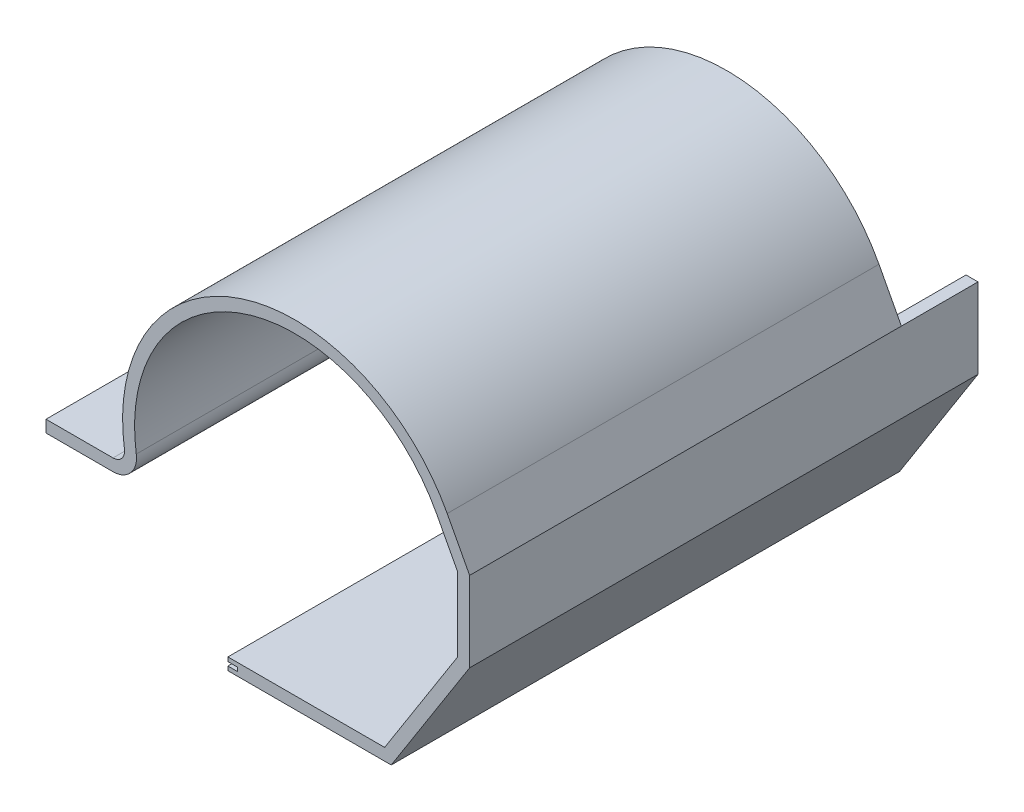
from build123d import *

# Parameters (mm, degrees)
SKETCH3_W                = 40
SKETCH3_H                = 30
SKETCH3_R                = 2.5
BOSS_EXTRUDE2_DEPTH      = 6.25
SKETCH4_W                = 40
SKETCH4_H                = 6.25
BOSS_EXTRUDE3_DEPTH      = 7.5
BOSS_EXTRUDE4_DEPTH      = 20
CHAMFER1_SIZE            = 2.5
SKETCH6_R                = 38
BOSS_EXTRUDE5_DEPTH      = 12.25
SKETCH8_R                = 28
BOSS_EXTRUDE7_DEPTH      = 10.5
SKETCH9_R                = 31.125
BOSS_EXTRUDE8_DEPTH      = 3.125
FILLET1_R                = 4
BOSS_EXTRUDE9_DEPTH      = 90
CHAMFER1_OF_MIRROR1_SIZE = 2.5
FILLET1_OF_MIRROR1_R     = 4
SKETCH12_R               = 2.5
BOSS_EXTRUDE10_DEPTH     = 30
SKETCH14_R               = 2.5
CUT_EXTRUDE1_DEPTH       = 10
CUT_EXTRUDE2_DEPTH       = 50
SKETCH17_W               = 1
SKETCH17_H               = 6.235194638
BOSS_EXTRUDE11_DEPTH     = 5
FILLET2_R                = 0.5
FILLET3_R                = 0.5
SKETCH18_W               = 524.380672346
SKETCH18_H               = 94.959875778
CUT_EXTRUDE3_DEPTH       = 174
SKETCH19_W               = 272.949766815
SKETCH19_H               = 179.225609408
CUT_EXTRUDE4_DEPTH       = 174


with BuildPart() as part:
    # Sketch3 → Boss-Extrude2 (new body)
    with BuildSketch(Plane.XY):
        with Locations((0, -25)):
            Rectangle(SKETCH3_W, SKETCH3_H)
        with Locations((7.5, -25)):
            Circle(SKETCH3_R, mode=Mode.SUBTRACT)
        with Locations((-7.5, -25)):
            Circle(SKETCH3_R, mode=Mode.SUBTRACT)
    boss_extrude2 = extrude(amount=BOSS_EXTRUDE2_DEPTH)

    # Sketch4 → Boss-Extrude3 (add)
    with BuildSketch(Plane.XY.offset(6.25)):
        with Locations((0, -36.875)):
            Rectangle(SKETCH4_W, SKETCH4_H)
    boss_extrude3 = extrude(amount=BOSS_EXTRUDE3_DEPTH)

    # Sketch5 → Boss-Extrude4 (add)
    with BuildSketch(Plane.XY.offset(13.75)):
        Polygon((-20, -40), (-88.428700673, -40), (-107.5, -10), (-107.5, 10), (-110.625, 10), (-110.625, -10.909213368), (-90.145103003, -43.125), (90.145103003, -43.125), (110.625, -10.909213368), (110.625, 10), (107.5, 10), (107.5, -10), (88.428700673, -40), (20, -40), align=None)
    boss_extrude4 = extrude(amount=-BOSS_EXTRUDE4_DEPTH)

    # Chamfer1
    chamfer1_edges = [part.edges().sort_by_distance(p)[0] for p in [
        (-20, -40, 6.875),
        (-20, -10, 3.125),
        (20, -10, 3.125),
        (20, -40, 6.875),
    ]]
    chamfer(chamfer1_edges, length=CHAMFER1_SIZE)

    # Sketch6 → Boss-Extrude5 (add)
    with BuildSketch(Plane.XY.offset(13.75)):
        with BuildLine():
            Line((-110.625, 10), (-104.767593775, 21.060353399))
            ThreePointArc((-104.767593775, 21.060353399), (-50.991609061, 42.764061819), (-20.479289941, -6.550295858))
            ThreePointArc((-20.479289941, -6.550295858), (-19.779069285, -8.956923473), (-17.5, -10))
            Line((-17.5, -10), (17.5, -10))
            ThreePointArc((17.5, -10), (19.779069285, -8.956923473), (20.479289941, -6.550295858))
            ThreePointArc((20.479289941, -6.550295858), (50.991609061, 42.764061819), (104.767593775, 21.060353399))
            Line((104.767593775, 21.060353399), (110.625, 10))
            Line((110.625, 10), (110.625, -10.909213368))
            Line((110.625, -10.909213368), (90.145103003, -43.125))
            Line((90.145103003, -43.125), (-90.145103003, -43.125))
            Line((-90.145103003, -43.125), (-110.625, -10.909213368))
            Line((-110.625, -10.909213368), (-110.625, 10))
        make_face()
        with Locations((-65, 0)):
            Circle(SKETCH6_R, mode=Mode.SUBTRACT)
        with Locations(Location((65, 0, 0), (0, 0, 180))):
            Circle(SKETCH6_R, mode=Mode.SUBTRACT)
    boss_extrude5 = extrude(amount=BOSS_EXTRUDE5_DEPTH)

    # Sketch8 → Boss-Extrude7 (add)
    with BuildSketch(Plane.XY.offset(26)):
        with BuildLine():
            Line((-104.767593775, 21.060353399), (-110.625, 10))
            Line((-110.625, 10), (-110.625, -10.909213368))
            Line((-110.625, -10.909213368), (-90.145103003, -43.125))
            Line((-90.145103003, -43.125), (90.145103003, -43.125))
            Line((90.145103003, -43.125), (110.625, -10.909213368))
            Line((110.625, -10.909213368), (110.625, 10))
            Line((110.625, 10), (104.767593775, 21.060353399))
            ThreePointArc((104.767593775, 21.060353399), (50.991609061, 42.764061819), (20.479289941, -6.550295858))
            ThreePointArc((20.479289941, -6.550295858), (19.779069285, -8.956923473), (17.5, -10))
            Line((17.5, -10), (-17.5, -10))
            ThreePointArc((-17.5, -10), (-19.779069285, -8.956923473), (-20.479289941, -6.550295858))
            ThreePointArc((-20.479289941, -6.550295858), (-50.991609061, 42.764061819), (-104.767593775, 21.060353399))
        make_face()
        with Locations(Location((-65, 0, 0), (0, 0, 180))):
            Circle(SKETCH8_R, mode=Mode.SUBTRACT)
        with Locations(Location((65, 0, 0), (0, 0, 180))):
            Circle(SKETCH8_R, mode=Mode.SUBTRACT)
    boss_extrude7 = extrude(amount=BOSS_EXTRUDE7_DEPTH)

    # Sketch9 → Boss-Extrude8 (add)
    with BuildSketch(Plane.XY.offset(36.5)):
        with Locations(Location((65, 0, 0), (0, 0, 180))):
            Circle(SKETCH9_R)
        with Locations((-65, 0)):
            Circle(SKETCH9_R)
    boss_extrude8 = extrude(amount=BOSS_EXTRUDE8_DEPTH)

    # Fillet1
    # the kernel refuses this fillet: 4 mm, written as the material it adds along each edge
    with BuildSketch(Plane(origin=(-65, 0, 36.5), x_dir=(1, 0, 0), z_dir=(0, -1, 0))) as fillet1_piece_1:
        with BuildLine():
            CenterArc((35.028123749, 4), FILLET1_R, 192.635625093, 77.364374907)
            Line((31.125, 3.125), (31.046937525, 3.1075))
            ThreePointArc((31.046937525, 3.1075), (31.045, 1.5625), (31.045, 0))
            Line((31.045, 0), (31.125, -0.08))
            Line((31.125, -0.08), (35.028123749, -0.08))
            Line((35.028123749, -0.08), (35.028123749, 0))
        make_face()
    revolve(axis=Axis((-65, 0, 36.5), (0, 0, 1)))
    with BuildSketch(Plane(origin=(65, 0, 36.5), x_dir=(-1, 0, 0), z_dir=(0, 1, 0))) as fillet1_piece_2:
        with BuildLine():
            CenterArc((35.028123749, 4), FILLET1_R, 192.635625093, 77.364374907)
            Line((31.125, 3.125), (31.046937525, 3.1075))
            ThreePointArc((31.046937525, 3.1075), (31.045, 1.5625), (31.045, 0))
            Line((31.045, 0), (31.125, -0.08))
            Line((31.125, -0.08), (35.028123749, -0.08))
            Line((35.028123749, -0.08), (35.028123749, 0))
        make_face()
    revolve(axis=Axis((65, 0, 36.5), (0, 0, 1)))

    # Sketch10 → Boss-Extrude9 (add)
    with BuildSketch(Plane.XY.offset(36.5)):
        with BuildLine():
            Line((-104.767593775, 21.060353399), (-110.625, 10))
            Line((-110.625, 10), (-110.625, -10.909213368))
            Line((-110.625, -10.909213368), (-90.145103003, -43.125))
            Line((-90.145103003, -43.125), (-47.5, -43.125))
            Line((-47.5, -43.125), (-47.5, -40))
            Line((-47.5, -40), (-88.428700673, -40))
            Line((-88.428700673, -40), (-107.5, -10))
            Line((-107.5, -10), (-107.5, 9.223599474))
            Line((-107.5, 9.223599474), (-102.005955319, 19.597828858))
            ThreePointArc((-102.005955319, 19.597828858), (-51.964413987, 39.794335304), (-23.571005917, -6.095414201))
            ThreePointArc((-23.571005917, -6.095414201), (-22.144141184, -10.999485568), (-17.5, -13.125))
            Line((-17.5, -13.125), (17.5, -13.125))
            ThreePointArc((17.5, -13.125), (22.144141184, -10.999485568), (23.571005917, -6.095414201))
            ThreePointArc((23.571005917, -6.095414201), (51.964413987, 39.794335304), (102.005955319, 19.597828858))
            Line((102.005955319, 19.597828858), (107.5, 9.223599474))
            Line((107.5, 9.223599474), (107.5, -10))
            Line((107.5, -10), (88.428700673, -40))
            Line((88.428700673, -40), (47.5, -40))
            Line((47.5, -40), (47.5, -43.125))
            Line((47.5, -43.125), (90.145103003, -43.125))
            Line((90.145103003, -43.125), (110.625, -10.909213368))
            Line((110.625, -10.909213368), (110.625, 10))
            Line((110.625, 10), (104.767593775, 21.060353399))
            ThreePointArc((104.767593775, 21.060353399), (50.991609061, 42.764061819), (20.479289941, -6.550295858))
            ThreePointArc((20.479289941, -6.550295858), (19.779069285, -8.956923473), (17.5, -10))
            Line((17.5, -10), (-17.5, -10))
            ThreePointArc((-17.5, -10), (-19.779069285, -8.956923473), (-20.479289941, -6.550295858))
            ThreePointArc((-20.479289941, -6.550295858), (-50.991609061, 42.764061819), (-104.767593775, 21.060353399))
        make_face()
    boss_extrude9 = extrude(amount=BOSS_EXTRUDE9_DEPTH)

    # Mirror1: Boss-Extrude2, Boss-Extrude3, Boss-Extrude4, Boss-Extrude5, Boss-Extrude7, Boss-Extrude8, Boss-Extrude9 across plane
    add(boss_extrude2.mirror(Plane(origin=(-65, 0, 126.5), x_dir=(1, 0, 0), z_dir=(0, 0, 1))))
    add(boss_extrude3.mirror(Plane(origin=(-65, 0, 126.5), x_dir=(1, 0, 0), z_dir=(0, 0, 1))))
    add(boss_extrude4.mirror(Plane(origin=(-65, 0, 126.5), x_dir=(1, 0, 0), z_dir=(0, 0, 1))))
    add(boss_extrude5.mirror(Plane(origin=(-65, 0, 126.5), x_dir=(1, 0, 0), z_dir=(0, 0, 1))))
    add(boss_extrude7.mirror(Plane(origin=(-65, 0, 126.5), x_dir=(1, 0, 0), z_dir=(0, 0, 1))))
    add(boss_extrude8.mirror(Plane(origin=(-65, 0, 126.5), x_dir=(1, 0, 0), z_dir=(0, 0, 1))))
    add(boss_extrude9.mirror(Plane(origin=(-65, 0, 126.5), x_dir=(1, 0, 0), z_dir=(0, 0, 1))))

    # Chamfer1 of Mirror1
    chamfer1_of_mirror1_edges = [part.edges().sort_by_distance(p)[0] for p in [
        (-20, -40, 246.125),
        (-20, -10, 249.875),
        (20, -10, 249.875),
        (20, -40, 246.125),
    ]]
    chamfer(chamfer1_of_mirror1_edges, length=CHAMFER1_OF_MIRROR1_SIZE)

    # Fillet1 of Mirror1
    # the kernel refuses this fillet: 4 mm, written as the material it adds along each edge
    with BuildSketch(Plane(origin=(-65, 0, 216.5), x_dir=(1, 0, 0), z_dir=(0, -1, 0))) as fillet1_of_mirror1_piece_1:
        with BuildLine():
            CenterArc((35.028123749, -4), FILLET1_OF_MIRROR1_R, 90, 77.364374907)
            Line((31.125, -3.125), (31.046937525, -3.1075))
            ThreePointArc((31.046937525, -3.1075), (31.045, -1.5625), (31.045, 0))
            Line((31.045, 0), (31.125, 0.08))
            Line((31.125, 0.08), (35.028123749, 0.08))
            Line((35.028123749, 0.08), (35.028123749, 0))
        make_face()
    revolve(axis=Axis((-65, 0, 216.5), (0, 0, 1)))
    with BuildSketch(Plane(origin=(65, 0, 216.5), x_dir=(-1, 0, 0), z_dir=(0, 1, 0))) as fillet1_of_mirror1_piece_2:
        with BuildLine():
            CenterArc((35.028123749, -4), FILLET1_OF_MIRROR1_R, 90, 77.364374907)
            Line((31.125, -3.125), (31.046937525, -3.1075))
            ThreePointArc((31.046937525, -3.1075), (31.045, -1.5625), (31.045, 0))
            Line((31.045, 0), (31.125, 0.08))
            Line((31.125, 0.08), (35.028123749, 0.08))
            Line((35.028123749, 0.08), (35.028123749, 0))
        make_face()
    revolve(axis=Axis((65, 0, 216.5), (0, 0, 1)))

    # Sketch12 → Boss-Extrude10 (add)
    with BuildSketch(Plane.XY.offset(253)):
        Polygon((-20, -12.5), (-20, -37.5), (-22.5, -40), (22.5, -40), (20, -37.5), (20, -12.5), (17.5, -10), (-17.5, -10), align=None)
        with Locations((7.5, -25)):
            Circle(SKETCH12_R, mode=Mode.SUBTRACT)
        with Locations((-7.5, -25)):
            Circle(SKETCH12_R, mode=Mode.SUBTRACT)
    boss_extrude10 = extrude(amount=-BOSS_EXTRUDE10_DEPTH)

    # Mirror2: Boss-Extrude10 across plane
    add(boss_extrude10.mirror(Plane(origin=(0, 0, 126.5), x_dir=(1, 0, 0), z_dir=(0, 0, -1))))

    # Sketch14 → Cut-Extrude1 (cut)
    with BuildSketch(Plane.XZ.offset(43.125)):
        with Locations((10, 237.75)):
            Circle(SKETCH14_R)
        with Locations(Location((-10, 237.75, 0), (0, 0, 180))):
            Circle(SKETCH14_R)
        with Locations((-10, 15.25)):
            Circle(SKETCH14_R)
        with Locations(Location((10, 15.25, 0), (0, 0, 180))):
            Circle(SKETCH14_R)
    extrude(amount=-CUT_EXTRUDE1_DEPTH, mode=Mode.SUBTRACT)

    # Sketch16 → Cut-Extrude2 (cut, symmetric)
    with BuildSketch(Plane(origin=(0, 0, 0), x_dir=(0, 0, -1), z_dir=(1, 0, 0))):
        Polygon((-215.5, -41.0625), (-215.5, -40), (-216.5, -40), (-216.5, -41.0625), (-216.5, -42.0625), (-36.5, -42.0625), (-36.5, -41.0625), align=None)
    cut_extrude2 = extrude(amount=CUT_EXTRUDE2_DEPTH, both=True, mode=Mode.SUBTRACT)

    # Sketch17 → Boss-Extrude11 (add)
    with BuildSketch(Plane(origin=(-47.5, 0, 0), x_dir=(0, 0, -1), z_dir=(1, 0, 0))):
        with Locations((-215, -37.944902681)):
            Rectangle(SKETCH17_W, SKETCH17_H)
    boss_extrude11 = extrude(amount=-BOSS_EXTRUDE11_DEPTH)

    # Fillet2
    fillet2_edges = [part.edges().sort_by_distance(p)[0] for p in [
        (-48.75, -41.0625, 215.5),
        (-50, -40, 214.5),
    ]]
    fillet(fillet2_edges, radius=FILLET2_R)

    # Mirror3: Cut-Extrude2, Boss-Extrude11 across plane
    add(cut_extrude2.mirror(Plane(origin=(0, 0, 0), x_dir=(0, 0, 1), z_dir=(1, 0, 0))), mode=Mode.SUBTRACT)
    add(boss_extrude11.mirror(Plane(origin=(0, 0, 0), x_dir=(0, 0, 1), z_dir=(1, 0, 0))))

    # Fillet3
    fillet3_edges = [part.edges().sort_by_distance(p)[0] for p in [
        (48.75, -41.0625, 215.5),
        (50, -40, 214.5),
    ]]
    fillet(fillet3_edges, radius=FILLET3_R)

    # Sketch18 → Cut-Extrude3 (cut)
    with BuildSketch(Plane(origin=(0, 0, 126.5), x_dir=(-1, 0, 0), z_dir=(0, 0, -1))):
        Rectangle(SKETCH18_W, SKETCH18_H)
    extrude(amount=-CUT_EXTRUDE3_DEPTH, mode=Mode.SUBTRACT)

    # Sketch19 → Cut-Extrude4 (cut)
    with BuildSketch(Plane(origin=(0, 0, 0), x_dir=(0, 0, -1), z_dir=(1, 0, 0))):
        with Locations((-54.462141768, 10)):
            Rectangle(SKETCH19_W, SKETCH19_H)
    extrude(amount=-CUT_EXTRUDE4_DEPTH, mode=Mode.SUBTRACT)


solid = part.part
